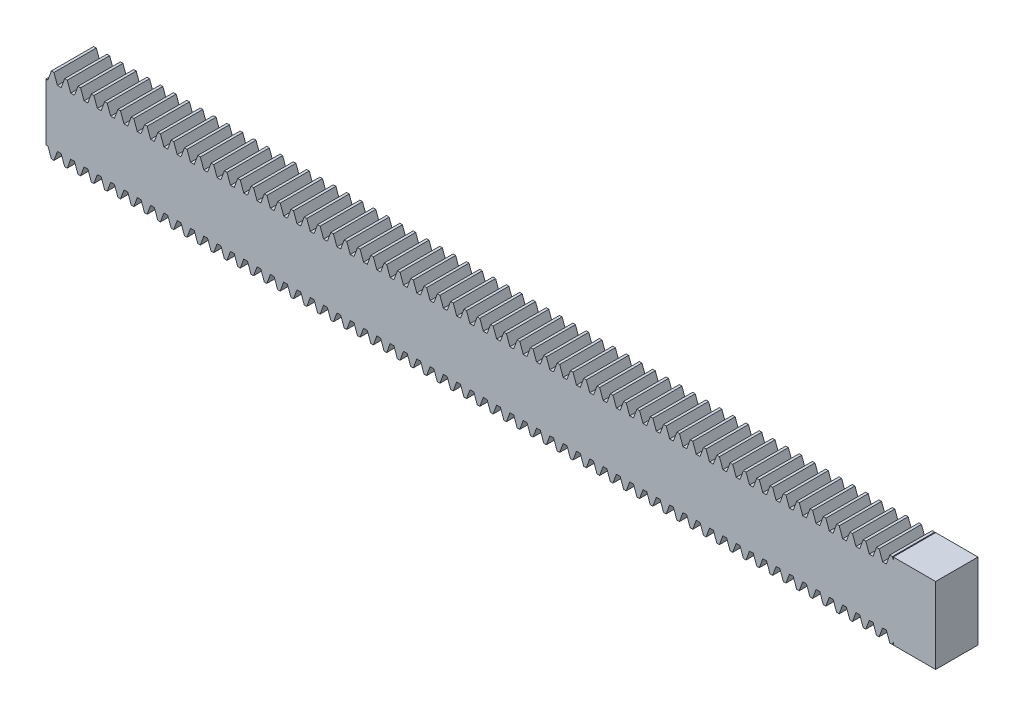
from build123d import *

# Parameters (mm, degrees)
BLANKSKE_W            = 200
BLANKSKE_H            = 9
BLANK_DEPTH           = 10
TOOTHCUTSIM_DEPTH     = 201.451989264
TEETHCUTS_COUNT       = 65
TEETHCUTS_PITCH       = 3.14159265
MIRROR1_COPY_1_DEPTH  = 201.451989264
MIRROR1_COPY_2_DEPTH  = 201.451989264
MIRROR1_COPY_3_DEPTH  = 201.451989264
MIRROR1_COPY_4_DEPTH  = 201.451989264
MIRROR1_COPY_5_DEPTH  = 201.451989264
MIRROR1_COPY_6_DEPTH  = 201.451989264
MIRROR1_COPY_7_DEPTH  = 201.451989264
MIRROR1_COPY_8_DEPTH  = 201.451989264
MIRROR1_COPY_9_DEPTH  = 201.451989264
MIRROR1_COPY_10_DEPTH = 201.451989264
MIRROR1_COPY_11_DEPTH = 201.451989264
MIRROR1_COPY_12_DEPTH = 201.451989264
MIRROR1_COPY_13_DEPTH = 201.451989264
MIRROR1_COPY_14_DEPTH = 201.451989264
MIRROR1_COPY_15_DEPTH = 201.451989264
MIRROR1_COPY_16_DEPTH = 201.451989264
MIRROR1_COPY_17_DEPTH = 201.451989264
MIRROR1_COPY_18_DEPTH = 201.451989264
MIRROR1_COPY_19_DEPTH = 201.451989264
MIRROR1_COPY_20_DEPTH = 201.451989264
MIRROR1_COPY_21_DEPTH = 201.451989264
MIRROR1_COPY_22_DEPTH = 201.451989264
MIRROR1_COPY_23_DEPTH = 201.451989264
MIRROR1_COPY_24_DEPTH = 201.451989264
MIRROR1_COPY_25_DEPTH = 201.451989264
MIRROR1_COPY_26_DEPTH = 201.451989264
MIRROR1_COPY_27_DEPTH = 201.451989264
MIRROR1_COPY_28_DEPTH = 201.451989264
MIRROR1_COPY_29_DEPTH = 201.451989264
MIRROR1_COPY_30_DEPTH = 201.451989264
MIRROR1_COPY_31_DEPTH = 201.451989264
MIRROR1_COPY_32_DEPTH = 201.451989264
MIRROR1_COPY_33_DEPTH = 201.451989264
MIRROR1_COPY_34_DEPTH = 201.451989264
MIRROR1_COPY_35_DEPTH = 201.451989264
MIRROR1_COPY_36_DEPTH = 201.451989264
MIRROR1_COPY_37_DEPTH = 201.451989264
MIRROR1_COPY_38_DEPTH = 201.451989264
MIRROR1_COPY_39_DEPTH = 201.451989264
MIRROR1_COPY_40_DEPTH = 201.451989264
MIRROR1_COPY_41_DEPTH = 201.451989264
MIRROR1_COPY_42_DEPTH = 201.451989264
MIRROR1_COPY_43_DEPTH = 201.451989264
MIRROR1_COPY_44_DEPTH = 201.451989264
MIRROR1_COPY_45_DEPTH = 201.451989264
MIRROR1_COPY_46_DEPTH = 201.451989264
MIRROR1_COPY_47_DEPTH = 201.451989264
MIRROR1_COPY_48_DEPTH = 201.451989264
MIRROR1_COPY_49_DEPTH = 201.451989264
MIRROR1_COPY_50_DEPTH = 201.451989264
MIRROR1_COPY_51_DEPTH = 201.451989264
MIRROR1_COPY_52_DEPTH = 201.451989264
MIRROR1_COPY_53_DEPTH = 201.451989264
MIRROR1_COPY_54_DEPTH = 201.451989264
MIRROR1_COPY_55_DEPTH = 201.451989264
MIRROR1_COPY_56_DEPTH = 201.451989264
MIRROR1_COPY_57_DEPTH = 201.451989264
MIRROR1_COPY_58_DEPTH = 201.451989264
MIRROR1_COPY_59_DEPTH = 201.451989264
MIRROR1_COPY_60_DEPTH = 201.451989264
MIRROR1_COPY_61_DEPTH = 201.451989264
MIRROR1_COPY_62_DEPTH = 201.451989264
MIRROR1_COPY_63_DEPTH = 201.451989264
MIRROR1_COPY_64_DEPTH = 201.451989264
SKETCH1_W             = 10
SKETCH1_H             = 18
BOSS_EXTRUDE1_DEPTH   = 10


with BuildPart() as part:
    # BlankSke → Blank (new body)
    with BuildSketch(Plane.XY):
        with Locations((100, 4.5)):
            Rectangle(BLANKSKE_W, BLANKSKE_H)
    blank = extrude(amount=-BLANK_DEPTH)

    # TooCutSkeSim → ToothCutSim (cut, through all)
    with BuildSketch(Plane.XY):
        Polygon((0.44443537, 6.75), (-0.44443537, 6.75), (-1.272613241, 9.0254), (1.272613241, 9.0254), align=None)
    toothcutsim = extrude(amount=-TOOTHCUTSIM_DEPTH, mode=Mode.SUBTRACT)

    # TeethCuts: ToothCutSim ×65
    with Locations(*[(i * TEETHCUTS_PITCH, 0, 0) for i in range(1, TEETHCUTS_COUNT)]):
        add(toothcutsim, mode=Mode.SUBTRACT)

    # Mirror1: Blank, ToothCutSim across plane
    add(blank.mirror(Plane.ZX))
    add(toothcutsim.mirror(Plane.ZX), mode=Mode.SUBTRACT)

    # Mirror1 copy 1 sketch → Mirror1 copy 1 (cut, through all)
    with BuildSketch(Plane(origin=(3.14159265, 0, 0), x_dir=(1, 0, 0), z_dir=(0, 0, 1))):
        Polygon((0.44443537, -6.75), (-0.44443537, -6.75), (-1.272613241, -9.0254), (1.272613241, -9.0254), align=None)
    extrude(amount=-MIRROR1_COPY_1_DEPTH, mode=Mode.SUBTRACT)

    # Mirror1 copy 2 sketch → Mirror1 copy 2 (cut, through all)
    with BuildSketch(Plane(origin=(6.2831853, 0, 0), x_dir=(1, 0, 0), z_dir=(0, 0, 1))):
        Polygon((0.44443537, -6.75), (-0.44443537, -6.75), (-1.272613241, -9.0254), (1.272613241, -9.0254), align=None)
    extrude(amount=-MIRROR1_COPY_2_DEPTH, mode=Mode.SUBTRACT)

    # Mirror1 copy 3 sketch → Mirror1 copy 3 (cut, through all)
    with BuildSketch(Plane(origin=(9.42477795, 0, 0), x_dir=(1, 0, 0), z_dir=(0, 0, 1))):
        Polygon((0.44443537, -6.75), (-0.44443537, -6.75), (-1.272613241, -9.0254), (1.272613241, -9.0254), align=None)
    extrude(amount=-MIRROR1_COPY_3_DEPTH, mode=Mode.SUBTRACT)

    # Mirror1 copy 4 sketch → Mirror1 copy 4 (cut, through all)
    with BuildSketch(Plane(origin=(12.5663706, 0, 0), x_dir=(1, 0, 0), z_dir=(0, 0, 1))):
        Polygon((0.44443537, -6.75), (-0.44443537, -6.75), (-1.272613241, -9.0254), (1.272613241, -9.0254), align=None)
    extrude(amount=-MIRROR1_COPY_4_DEPTH, mode=Mode.SUBTRACT)

    # Mirror1 copy 5 sketch → Mirror1 copy 5 (cut, through all)
    with BuildSketch(Plane(origin=(15.70796325, 0, 0), x_dir=(1, 0, 0), z_dir=(0, 0, 1))):
        Polygon((0.44443537, -6.75), (-0.44443537, -6.75), (-1.272613241, -9.0254), (1.272613241, -9.0254), align=None)
    extrude(amount=-MIRROR1_COPY_5_DEPTH, mode=Mode.SUBTRACT)

    # Mirror1 copy 6 sketch → Mirror1 copy 6 (cut, through all)
    with BuildSketch(Plane(origin=(18.8495559, 0, 0), x_dir=(1, 0, 0), z_dir=(0, 0, 1))):
        Polygon((0.44443537, -6.75), (-0.44443537, -6.75), (-1.272613241, -9.0254), (1.272613241, -9.0254), align=None)
    extrude(amount=-MIRROR1_COPY_6_DEPTH, mode=Mode.SUBTRACT)

    # Mirror1 copy 7 sketch → Mirror1 copy 7 (cut, through all)
    with BuildSketch(Plane(origin=(21.99114855, 0, 0), x_dir=(1, 0, 0), z_dir=(0, 0, 1))):
        Polygon((0.44443537, -6.75), (-0.44443537, -6.75), (-1.272613241, -9.0254), (1.272613241, -9.0254), align=None)
    extrude(amount=-MIRROR1_COPY_7_DEPTH, mode=Mode.SUBTRACT)

    # Mirror1 copy 8 sketch → Mirror1 copy 8 (cut, through all)
    with BuildSketch(Plane(origin=(25.1327412, 0, 0), x_dir=(1, 0, 0), z_dir=(0, 0, 1))):
        Polygon((0.44443537, -6.75), (-0.44443537, -6.75), (-1.272613241, -9.0254), (1.272613241, -9.0254), align=None)
    extrude(amount=-MIRROR1_COPY_8_DEPTH, mode=Mode.SUBTRACT)

    # Mirror1 copy 9 sketch → Mirror1 copy 9 (cut, through all)
    with BuildSketch(Plane(origin=(28.27433385, 0, 0), x_dir=(1, 0, 0), z_dir=(0, 0, 1))):
        Polygon((0.44443537, -6.75), (-0.44443537, -6.75), (-1.272613241, -9.0254), (1.272613241, -9.0254), align=None)
    extrude(amount=-MIRROR1_COPY_9_DEPTH, mode=Mode.SUBTRACT)

    # Mirror1 copy 10 sketch → Mirror1 copy 10 (cut, through all)
    with BuildSketch(Plane(origin=(31.4159265, 0, 0), x_dir=(1, 0, 0), z_dir=(0, 0, 1))):
        Polygon((0.44443537, -6.75), (-0.44443537, -6.75), (-1.272613241, -9.0254), (1.272613241, -9.0254), align=None)
    extrude(amount=-MIRROR1_COPY_10_DEPTH, mode=Mode.SUBTRACT)

    # Mirror1 copy 11 sketch → Mirror1 copy 11 (cut, through all)
    with BuildSketch(Plane(origin=(34.55751915, 0, 0), x_dir=(1, 0, 0), z_dir=(0, 0, 1))):
        Polygon((0.44443537, -6.75), (-0.44443537, -6.75), (-1.272613241, -9.0254), (1.272613241, -9.0254), align=None)
    extrude(amount=-MIRROR1_COPY_11_DEPTH, mode=Mode.SUBTRACT)

    # Mirror1 copy 12 sketch → Mirror1 copy 12 (cut, through all)
    with BuildSketch(Plane(origin=(37.6991118, 0, 0), x_dir=(1, 0, 0), z_dir=(0, 0, 1))):
        Polygon((0.44443537, -6.75), (-0.44443537, -6.75), (-1.272613241, -9.0254), (1.272613241, -9.0254), align=None)
    extrude(amount=-MIRROR1_COPY_12_DEPTH, mode=Mode.SUBTRACT)

    # Mirror1 copy 13 sketch → Mirror1 copy 13 (cut, through all)
    with BuildSketch(Plane(origin=(40.84070445, 0, 0), x_dir=(1, 0, 0), z_dir=(0, 0, 1))):
        Polygon((0.44443537, -6.75), (-0.44443537, -6.75), (-1.272613241, -9.0254), (1.272613241, -9.0254), align=None)
    extrude(amount=-MIRROR1_COPY_13_DEPTH, mode=Mode.SUBTRACT)

    # Mirror1 copy 14 sketch → Mirror1 copy 14 (cut, through all)
    with BuildSketch(Plane(origin=(43.9822971, 0, 0), x_dir=(1, 0, 0), z_dir=(0, 0, 1))):
        Polygon((0.44443537, -6.75), (-0.44443537, -6.75), (-1.272613241, -9.0254), (1.272613241, -9.0254), align=None)
    extrude(amount=-MIRROR1_COPY_14_DEPTH, mode=Mode.SUBTRACT)

    # Mirror1 copy 15 sketch → Mirror1 copy 15 (cut, through all)
    with BuildSketch(Plane(origin=(47.12388975, 0, 0), x_dir=(1, 0, 0), z_dir=(0, 0, 1))):
        Polygon((0.44443537, -6.75), (-0.44443537, -6.75), (-1.272613241, -9.0254), (1.272613241, -9.0254), align=None)
    extrude(amount=-MIRROR1_COPY_15_DEPTH, mode=Mode.SUBTRACT)

    # Mirror1 copy 16 sketch → Mirror1 copy 16 (cut, through all)
    with BuildSketch(Plane(origin=(50.2654824, 0, 0), x_dir=(1, 0, 0), z_dir=(0, 0, 1))):
        Polygon((0.44443537, -6.75), (-0.44443537, -6.75), (-1.272613241, -9.0254), (1.272613241, -9.0254), align=None)
    extrude(amount=-MIRROR1_COPY_16_DEPTH, mode=Mode.SUBTRACT)

    # Mirror1 copy 17 sketch → Mirror1 copy 17 (cut, through all)
    with BuildSketch(Plane(origin=(53.40707505, 0, 0), x_dir=(1, 0, 0), z_dir=(0, 0, 1))):
        Polygon((0.44443537, -6.75), (-0.44443537, -6.75), (-1.272613241, -9.0254), (1.272613241, -9.0254), align=None)
    extrude(amount=-MIRROR1_COPY_17_DEPTH, mode=Mode.SUBTRACT)

    # Mirror1 copy 18 sketch → Mirror1 copy 18 (cut, through all)
    with BuildSketch(Plane(origin=(56.5486677, 0, 0), x_dir=(1, 0, 0), z_dir=(0, 0, 1))):
        Polygon((0.44443537, -6.75), (-0.44443537, -6.75), (-1.272613241, -9.0254), (1.272613241, -9.0254), align=None)
    extrude(amount=-MIRROR1_COPY_18_DEPTH, mode=Mode.SUBTRACT)

    # Mirror1 copy 19 sketch → Mirror1 copy 19 (cut, through all)
    with BuildSketch(Plane(origin=(59.69026035, 0, 0), x_dir=(1, 0, 0), z_dir=(0, 0, 1))):
        Polygon((0.44443537, -6.75), (-0.44443537, -6.75), (-1.272613241, -9.0254), (1.272613241, -9.0254), align=None)
    extrude(amount=-MIRROR1_COPY_19_DEPTH, mode=Mode.SUBTRACT)

    # Mirror1 copy 20 sketch → Mirror1 copy 20 (cut, through all)
    with BuildSketch(Plane(origin=(62.831853, 0, 0), x_dir=(1, 0, 0), z_dir=(0, 0, 1))):
        Polygon((0.44443537, -6.75), (-0.44443537, -6.75), (-1.272613241, -9.0254), (1.272613241, -9.0254), align=None)
    extrude(amount=-MIRROR1_COPY_20_DEPTH, mode=Mode.SUBTRACT)

    # Mirror1 copy 21 sketch → Mirror1 copy 21 (cut, through all)
    with BuildSketch(Plane(origin=(65.97344565, 0, 0), x_dir=(1, 0, 0), z_dir=(0, 0, 1))):
        Polygon((0.44443537, -6.75), (-0.44443537, -6.75), (-1.272613241, -9.0254), (1.272613241, -9.0254), align=None)
    extrude(amount=-MIRROR1_COPY_21_DEPTH, mode=Mode.SUBTRACT)

    # Mirror1 copy 22 sketch → Mirror1 copy 22 (cut, through all)
    with BuildSketch(Plane(origin=(69.1150383, 0, 0), x_dir=(1, 0, 0), z_dir=(0, 0, 1))):
        Polygon((0.44443537, -6.75), (-0.44443537, -6.75), (-1.272613241, -9.0254), (1.272613241, -9.0254), align=None)
    extrude(amount=-MIRROR1_COPY_22_DEPTH, mode=Mode.SUBTRACT)

    # Mirror1 copy 23 sketch → Mirror1 copy 23 (cut, through all)
    with BuildSketch(Plane(origin=(72.25663095, 0, 0), x_dir=(1, 0, 0), z_dir=(0, 0, 1))):
        Polygon((0.44443537, -6.75), (-0.44443537, -6.75), (-1.272613241, -9.0254), (1.272613241, -9.0254), align=None)
    extrude(amount=-MIRROR1_COPY_23_DEPTH, mode=Mode.SUBTRACT)

    # Mirror1 copy 24 sketch → Mirror1 copy 24 (cut, through all)
    with BuildSketch(Plane(origin=(75.3982236, 0, 0), x_dir=(1, 0, 0), z_dir=(0, 0, 1))):
        Polygon((0.44443537, -6.75), (-0.44443537, -6.75), (-1.272613241, -9.0254), (1.272613241, -9.0254), align=None)
    extrude(amount=-MIRROR1_COPY_24_DEPTH, mode=Mode.SUBTRACT)

    # Mirror1 copy 25 sketch → Mirror1 copy 25 (cut, through all)
    with BuildSketch(Plane(origin=(78.53981625, 0, 0), x_dir=(1, 0, 0), z_dir=(0, 0, 1))):
        Polygon((0.44443537, -6.75), (-0.44443537, -6.75), (-1.272613241, -9.0254), (1.272613241, -9.0254), align=None)
    extrude(amount=-MIRROR1_COPY_25_DEPTH, mode=Mode.SUBTRACT)

    # Mirror1 copy 26 sketch → Mirror1 copy 26 (cut, through all)
    with BuildSketch(Plane(origin=(81.6814089, 0, 0), x_dir=(1, 0, 0), z_dir=(0, 0, 1))):
        Polygon((0.44443537, -6.75), (-0.44443537, -6.75), (-1.272613241, -9.0254), (1.272613241, -9.0254), align=None)
    extrude(amount=-MIRROR1_COPY_26_DEPTH, mode=Mode.SUBTRACT)

    # Mirror1 copy 27 sketch → Mirror1 copy 27 (cut, through all)
    with BuildSketch(Plane(origin=(84.82300155, 0, 0), x_dir=(1, 0, 0), z_dir=(0, 0, 1))):
        Polygon((0.44443537, -6.75), (-0.44443537, -6.75), (-1.272613241, -9.0254), (1.272613241, -9.0254), align=None)
    extrude(amount=-MIRROR1_COPY_27_DEPTH, mode=Mode.SUBTRACT)

    # Mirror1 copy 28 sketch → Mirror1 copy 28 (cut, through all)
    with BuildSketch(Plane(origin=(87.9645942, 0, 0), x_dir=(1, 0, 0), z_dir=(0, 0, 1))):
        Polygon((0.44443537, -6.75), (-0.44443537, -6.75), (-1.272613241, -9.0254), (1.272613241, -9.0254), align=None)
    extrude(amount=-MIRROR1_COPY_28_DEPTH, mode=Mode.SUBTRACT)

    # Mirror1 copy 29 sketch → Mirror1 copy 29 (cut, through all)
    with BuildSketch(Plane(origin=(91.10618685, 0, 0), x_dir=(1, 0, 0), z_dir=(0, 0, 1))):
        Polygon((0.44443537, -6.75), (-0.44443537, -6.75), (-1.272613241, -9.0254), (1.272613241, -9.0254), align=None)
    extrude(amount=-MIRROR1_COPY_29_DEPTH, mode=Mode.SUBTRACT)

    # Mirror1 copy 30 sketch → Mirror1 copy 30 (cut, through all)
    with BuildSketch(Plane(origin=(94.2477795, 0, 0), x_dir=(1, 0, 0), z_dir=(0, 0, 1))):
        Polygon((0.44443537, -6.75), (-0.44443537, -6.75), (-1.272613241, -9.0254), (1.272613241, -9.0254), align=None)
    extrude(amount=-MIRROR1_COPY_30_DEPTH, mode=Mode.SUBTRACT)

    # Mirror1 copy 31 sketch → Mirror1 copy 31 (cut, through all)
    with BuildSketch(Plane(origin=(97.38937215, 0, 0), x_dir=(1, 0, 0), z_dir=(0, 0, 1))):
        Polygon((0.44443537, -6.75), (-0.44443537, -6.75), (-1.272613241, -9.0254), (1.272613241, -9.0254), align=None)
    extrude(amount=-MIRROR1_COPY_31_DEPTH, mode=Mode.SUBTRACT)

    # Mirror1 copy 32 sketch → Mirror1 copy 32 (cut, through all)
    with BuildSketch(Plane(origin=(100.5309648, 0, 0), x_dir=(1, 0, 0), z_dir=(0, 0, 1))):
        Polygon((0.44443537, -6.75), (-0.44443537, -6.75), (-1.272613241, -9.0254), (1.272613241, -9.0254), align=None)
    extrude(amount=-MIRROR1_COPY_32_DEPTH, mode=Mode.SUBTRACT)

    # Mirror1 copy 33 sketch → Mirror1 copy 33 (cut, through all)
    with BuildSketch(Plane(origin=(103.67255745, 0, 0), x_dir=(1, 0, 0), z_dir=(0, 0, 1))):
        Polygon((0.44443537, -6.75), (-0.44443537, -6.75), (-1.272613241, -9.0254), (1.272613241, -9.0254), align=None)
    extrude(amount=-MIRROR1_COPY_33_DEPTH, mode=Mode.SUBTRACT)

    # Mirror1 copy 34 sketch → Mirror1 copy 34 (cut, through all)
    with BuildSketch(Plane(origin=(106.8141501, 0, 0), x_dir=(1, 0, 0), z_dir=(0, 0, 1))):
        Polygon((0.44443537, -6.75), (-0.44443537, -6.75), (-1.272613241, -9.0254), (1.272613241, -9.0254), align=None)
    extrude(amount=-MIRROR1_COPY_34_DEPTH, mode=Mode.SUBTRACT)

    # Mirror1 copy 35 sketch → Mirror1 copy 35 (cut, through all)
    with BuildSketch(Plane(origin=(109.95574275, 0, 0), x_dir=(1, 0, 0), z_dir=(0, 0, 1))):
        Polygon((0.44443537, -6.75), (-0.44443537, -6.75), (-1.272613241, -9.0254), (1.272613241, -9.0254), align=None)
    extrude(amount=-MIRROR1_COPY_35_DEPTH, mode=Mode.SUBTRACT)

    # Mirror1 copy 36 sketch → Mirror1 copy 36 (cut, through all)
    with BuildSketch(Plane(origin=(113.0973354, 0, 0), x_dir=(1, 0, 0), z_dir=(0, 0, 1))):
        Polygon((0.44443537, -6.75), (-0.44443537, -6.75), (-1.272613241, -9.0254), (1.272613241, -9.0254), align=None)
    extrude(amount=-MIRROR1_COPY_36_DEPTH, mode=Mode.SUBTRACT)

    # Mirror1 copy 37 sketch → Mirror1 copy 37 (cut, through all)
    with BuildSketch(Plane(origin=(116.23892805, 0, 0), x_dir=(1, 0, 0), z_dir=(0, 0, 1))):
        Polygon((0.44443537, -6.75), (-0.44443537, -6.75), (-1.272613241, -9.0254), (1.272613241, -9.0254), align=None)
    extrude(amount=-MIRROR1_COPY_37_DEPTH, mode=Mode.SUBTRACT)

    # Mirror1 copy 38 sketch → Mirror1 copy 38 (cut, through all)
    with BuildSketch(Plane(origin=(119.3805207, 0, 0), x_dir=(1, 0, 0), z_dir=(0, 0, 1))):
        Polygon((0.44443537, -6.75), (-0.44443537, -6.75), (-1.272613241, -9.0254), (1.272613241, -9.0254), align=None)
    extrude(amount=-MIRROR1_COPY_38_DEPTH, mode=Mode.SUBTRACT)

    # Mirror1 copy 39 sketch → Mirror1 copy 39 (cut, through all)
    with BuildSketch(Plane(origin=(122.52211335, 0, 0), x_dir=(1, 0, 0), z_dir=(0, 0, 1))):
        Polygon((0.44443537, -6.75), (-0.44443537, -6.75), (-1.272613241, -9.0254), (1.272613241, -9.0254), align=None)
    extrude(amount=-MIRROR1_COPY_39_DEPTH, mode=Mode.SUBTRACT)

    # Mirror1 copy 40 sketch → Mirror1 copy 40 (cut, through all)
    with BuildSketch(Plane(origin=(125.663706, 0, 0), x_dir=(1, 0, 0), z_dir=(0, 0, 1))):
        Polygon((0.44443537, -6.75), (-0.44443537, -6.75), (-1.272613241, -9.0254), (1.272613241, -9.0254), align=None)
    extrude(amount=-MIRROR1_COPY_40_DEPTH, mode=Mode.SUBTRACT)

    # Mirror1 copy 41 sketch → Mirror1 copy 41 (cut, through all)
    with BuildSketch(Plane(origin=(128.80529865, 0, 0), x_dir=(1, 0, 0), z_dir=(0, 0, 1))):
        Polygon((0.44443537, -6.75), (-0.44443537, -6.75), (-1.272613241, -9.0254), (1.272613241, -9.0254), align=None)
    extrude(amount=-MIRROR1_COPY_41_DEPTH, mode=Mode.SUBTRACT)

    # Mirror1 copy 42 sketch → Mirror1 copy 42 (cut, through all)
    with BuildSketch(Plane(origin=(131.9468913, 0, 0), x_dir=(1, 0, 0), z_dir=(0, 0, 1))):
        Polygon((0.44443537, -6.75), (-0.44443537, -6.75), (-1.272613241, -9.0254), (1.272613241, -9.0254), align=None)
    extrude(amount=-MIRROR1_COPY_42_DEPTH, mode=Mode.SUBTRACT)

    # Mirror1 copy 43 sketch → Mirror1 copy 43 (cut, through all)
    with BuildSketch(Plane(origin=(135.08848395, 0, 0), x_dir=(1, 0, 0), z_dir=(0, 0, 1))):
        Polygon((0.44443537, -6.75), (-0.44443537, -6.75), (-1.272613241, -9.0254), (1.272613241, -9.0254), align=None)
    extrude(amount=-MIRROR1_COPY_43_DEPTH, mode=Mode.SUBTRACT)

    # Mirror1 copy 44 sketch → Mirror1 copy 44 (cut, through all)
    with BuildSketch(Plane(origin=(138.2300766, 0, 0), x_dir=(1, 0, 0), z_dir=(0, 0, 1))):
        Polygon((0.44443537, -6.75), (-0.44443537, -6.75), (-1.272613241, -9.0254), (1.272613241, -9.0254), align=None)
    extrude(amount=-MIRROR1_COPY_44_DEPTH, mode=Mode.SUBTRACT)

    # Mirror1 copy 45 sketch → Mirror1 copy 45 (cut, through all)
    with BuildSketch(Plane(origin=(141.37166925, 0, 0), x_dir=(1, 0, 0), z_dir=(0, 0, 1))):
        Polygon((0.44443537, -6.75), (-0.44443537, -6.75), (-1.272613241, -9.0254), (1.272613241, -9.0254), align=None)
    extrude(amount=-MIRROR1_COPY_45_DEPTH, mode=Mode.SUBTRACT)

    # Mirror1 copy 46 sketch → Mirror1 copy 46 (cut, through all)
    with BuildSketch(Plane(origin=(144.5132619, 0, 0), x_dir=(1, 0, 0), z_dir=(0, 0, 1))):
        Polygon((0.44443537, -6.75), (-0.44443537, -6.75), (-1.272613241, -9.0254), (1.272613241, -9.0254), align=None)
    extrude(amount=-MIRROR1_COPY_46_DEPTH, mode=Mode.SUBTRACT)

    # Mirror1 copy 47 sketch → Mirror1 copy 47 (cut, through all)
    with BuildSketch(Plane(origin=(147.65485455, 0, 0), x_dir=(1, 0, 0), z_dir=(0, 0, 1))):
        Polygon((0.44443537, -6.75), (-0.44443537, -6.75), (-1.272613241, -9.0254), (1.272613241, -9.0254), align=None)
    extrude(amount=-MIRROR1_COPY_47_DEPTH, mode=Mode.SUBTRACT)

    # Mirror1 copy 48 sketch → Mirror1 copy 48 (cut, through all)
    with BuildSketch(Plane(origin=(150.7964472, 0, 0), x_dir=(1, 0, 0), z_dir=(0, 0, 1))):
        Polygon((0.44443537, -6.75), (-0.44443537, -6.75), (-1.272613241, -9.0254), (1.272613241, -9.0254), align=None)
    extrude(amount=-MIRROR1_COPY_48_DEPTH, mode=Mode.SUBTRACT)

    # Mirror1 copy 49 sketch → Mirror1 copy 49 (cut, through all)
    with BuildSketch(Plane(origin=(153.93803985, 0, 0), x_dir=(1, 0, 0), z_dir=(0, 0, 1))):
        Polygon((0.44443537, -6.75), (-0.44443537, -6.75), (-1.272613241, -9.0254), (1.272613241, -9.0254), align=None)
    extrude(amount=-MIRROR1_COPY_49_DEPTH, mode=Mode.SUBTRACT)

    # Mirror1 copy 50 sketch → Mirror1 copy 50 (cut, through all)
    with BuildSketch(Plane(origin=(157.0796325, 0, 0), x_dir=(1, 0, 0), z_dir=(0, 0, 1))):
        Polygon((0.44443537, -6.75), (-0.44443537, -6.75), (-1.272613241, -9.0254), (1.272613241, -9.0254), align=None)
    extrude(amount=-MIRROR1_COPY_50_DEPTH, mode=Mode.SUBTRACT)

    # Mirror1 copy 51 sketch → Mirror1 copy 51 (cut, through all)
    with BuildSketch(Plane(origin=(160.22122515, 0, 0), x_dir=(1, 0, 0), z_dir=(0, 0, 1))):
        Polygon((0.44443537, -6.75), (-0.44443537, -6.75), (-1.272613241, -9.0254), (1.272613241, -9.0254), align=None)
    extrude(amount=-MIRROR1_COPY_51_DEPTH, mode=Mode.SUBTRACT)

    # Mirror1 copy 52 sketch → Mirror1 copy 52 (cut, through all)
    with BuildSketch(Plane(origin=(163.3628178, 0, 0), x_dir=(1, 0, 0), z_dir=(0, 0, 1))):
        Polygon((0.44443537, -6.75), (-0.44443537, -6.75), (-1.272613241, -9.0254), (1.272613241, -9.0254), align=None)
    extrude(amount=-MIRROR1_COPY_52_DEPTH, mode=Mode.SUBTRACT)

    # Mirror1 copy 53 sketch → Mirror1 copy 53 (cut, through all)
    with BuildSketch(Plane(origin=(166.50441045, 0, 0), x_dir=(1, 0, 0), z_dir=(0, 0, 1))):
        Polygon((0.44443537, -6.75), (-0.44443537, -6.75), (-1.272613241, -9.0254), (1.272613241, -9.0254), align=None)
    extrude(amount=-MIRROR1_COPY_53_DEPTH, mode=Mode.SUBTRACT)

    # Mirror1 copy 54 sketch → Mirror1 copy 54 (cut, through all)
    with BuildSketch(Plane(origin=(169.6460031, 0, 0), x_dir=(1, 0, 0), z_dir=(0, 0, 1))):
        Polygon((0.44443537, -6.75), (-0.44443537, -6.75), (-1.272613241, -9.0254), (1.272613241, -9.0254), align=None)
    extrude(amount=-MIRROR1_COPY_54_DEPTH, mode=Mode.SUBTRACT)

    # Mirror1 copy 55 sketch → Mirror1 copy 55 (cut, through all)
    with BuildSketch(Plane(origin=(172.78759575, 0, 0), x_dir=(1, 0, 0), z_dir=(0, 0, 1))):
        Polygon((0.44443537, -6.75), (-0.44443537, -6.75), (-1.272613241, -9.0254), (1.272613241, -9.0254), align=None)
    extrude(amount=-MIRROR1_COPY_55_DEPTH, mode=Mode.SUBTRACT)

    # Mirror1 copy 56 sketch → Mirror1 copy 56 (cut, through all)
    with BuildSketch(Plane(origin=(175.9291884, 0, 0), x_dir=(1, 0, 0), z_dir=(0, 0, 1))):
        Polygon((0.44443537, -6.75), (-0.44443537, -6.75), (-1.272613241, -9.0254), (1.272613241, -9.0254), align=None)
    extrude(amount=-MIRROR1_COPY_56_DEPTH, mode=Mode.SUBTRACT)

    # Mirror1 copy 57 sketch → Mirror1 copy 57 (cut, through all)
    with BuildSketch(Plane(origin=(179.07078105, 0, 0), x_dir=(1, 0, 0), z_dir=(0, 0, 1))):
        Polygon((0.44443537, -6.75), (-0.44443537, -6.75), (-1.272613241, -9.0254), (1.272613241, -9.0254), align=None)
    extrude(amount=-MIRROR1_COPY_57_DEPTH, mode=Mode.SUBTRACT)

    # Mirror1 copy 58 sketch → Mirror1 copy 58 (cut, through all)
    with BuildSketch(Plane(origin=(182.2123737, 0, 0), x_dir=(1, 0, 0), z_dir=(0, 0, 1))):
        Polygon((0.44443537, -6.75), (-0.44443537, -6.75), (-1.272613241, -9.0254), (1.272613241, -9.0254), align=None)
    extrude(amount=-MIRROR1_COPY_58_DEPTH, mode=Mode.SUBTRACT)

    # Mirror1 copy 59 sketch → Mirror1 copy 59 (cut, through all)
    with BuildSketch(Plane(origin=(185.35396635, 0, 0), x_dir=(1, 0, 0), z_dir=(0, 0, 1))):
        Polygon((0.44443537, -6.75), (-0.44443537, -6.75), (-1.272613241, -9.0254), (1.272613241, -9.0254), align=None)
    extrude(amount=-MIRROR1_COPY_59_DEPTH, mode=Mode.SUBTRACT)

    # Mirror1 copy 60 sketch → Mirror1 copy 60 (cut, through all)
    with BuildSketch(Plane(origin=(188.495559, 0, 0), x_dir=(1, 0, 0), z_dir=(0, 0, 1))):
        Polygon((0.44443537, -6.75), (-0.44443537, -6.75), (-1.272613241, -9.0254), (1.272613241, -9.0254), align=None)
    extrude(amount=-MIRROR1_COPY_60_DEPTH, mode=Mode.SUBTRACT)

    # Mirror1 copy 61 sketch → Mirror1 copy 61 (cut, through all)
    with BuildSketch(Plane(origin=(191.63715165, 0, 0), x_dir=(1, 0, 0), z_dir=(0, 0, 1))):
        Polygon((0.44443537, -6.75), (-0.44443537, -6.75), (-1.272613241, -9.0254), (1.272613241, -9.0254), align=None)
    extrude(amount=-MIRROR1_COPY_61_DEPTH, mode=Mode.SUBTRACT)

    # Mirror1 copy 62 sketch → Mirror1 copy 62 (cut, through all)
    with BuildSketch(Plane(origin=(194.7787443, 0, 0), x_dir=(1, 0, 0), z_dir=(0, 0, 1))):
        Polygon((0.44443537, -6.75), (-0.44443537, -6.75), (-1.272613241, -9.0254), (1.272613241, -9.0254), align=None)
    extrude(amount=-MIRROR1_COPY_62_DEPTH, mode=Mode.SUBTRACT)

    # Mirror1 copy 63 sketch → Mirror1 copy 63 (cut, through all)
    with BuildSketch(Plane(origin=(197.92033695, 0, 0), x_dir=(1, 0, 0), z_dir=(0, 0, 1))):
        Polygon((0.44443537, -6.75), (-0.44443537, -6.75), (-1.272613241, -9.0254), (1.272613241, -9.0254), align=None)
    extrude(amount=-MIRROR1_COPY_63_DEPTH, mode=Mode.SUBTRACT)

    # Mirror1 copy 64 sketch → Mirror1 copy 64 (cut, through all)
    with BuildSketch(Plane(origin=(201.0619296, 0, 0), x_dir=(1, 0, 0), z_dir=(0, 0, 1))):
        Polygon((0.44443537, -6.75), (-0.44443537, -6.75), (-1.272613241, -9.0254), (1.272613241, -9.0254), align=None)
    extrude(amount=-MIRROR1_COPY_64_DEPTH, mode=Mode.SUBTRACT)

    # Sketch1 → Boss-Extrude1 (add)
    with BuildSketch(Plane(origin=(200, 0, 0), x_dir=(0, 0, -1), z_dir=(1, 0, 0))):
        with Locations((5, 0)):
            Rectangle(SKETCH1_W, SKETCH1_H)
    extrude(amount=BOSS_EXTRUDE1_DEPTH)


solid = part.part
